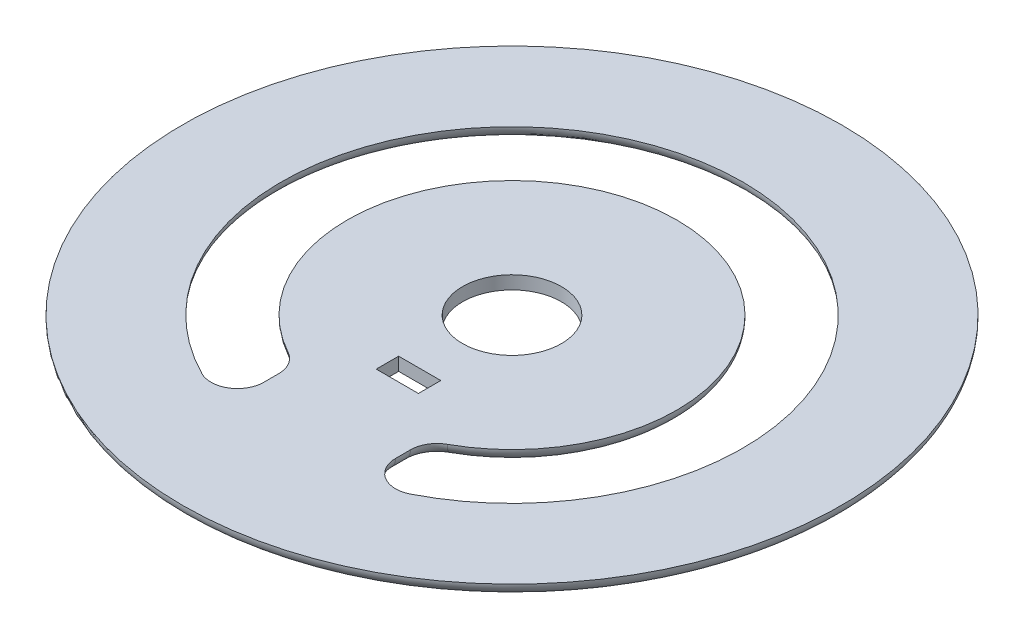
from build123d import *

# Parameters (mm, degrees)
SKETCH1_R           = 25
SKETCH1_R_2         = 3.75
SKETCH1_W           = 3.2
SKETCH1_H           = 1.7
BOSS_EXTRUDE1_DEPTH = 1
FILLET1_R           = 2
FILLET2_R           = 1


with BuildPart() as part:
    # Sketch1 → Boss-Extrude1 (new body)
    with BuildSketch(Plane(origin=(0, 0, 0), x_dir=(1, 0, 0), z_dir=(0, 1, 0))):
        with Locations(Location((0, 0, 0), (0, 0, 270))):
            Circle(SKETCH1_R)
        with Locations(Location((0, 0, 0), (0, 0, 270))):
            Circle(SKETCH1_R_2, mode=Mode.SUBTRACT)
        with BuildLine():
            Line((-5, -11.456439237), (-5, -16.770509831))
            ThreePointArc((-5, -16.770509831), (0, 17.5), (5, -16.770509831))
            Line((5, -16.770509831), (5, -11.456439237))
            ThreePointArc((5, -11.456439237), (0, 12.5), (-5, -11.456439237))
        make_face(mode=Mode.SUBTRACT)
        with Locations((0, -7.85)):
            Rectangle(SKETCH1_W, SKETCH1_H, mode=Mode.SUBTRACT)
    extrude(amount=BOSS_EXTRUDE1_DEPTH)

    # Fillet1
    fillet1_edges = [part.edges().sort_by_distance(p)[0] for p in [
        (-5, 0.5, 11.456439237),
        (5, 0.5, 11.456439237),
        (5, 0.5, 16.770509831),
        (-5, 0.5, 16.770509831),
    ]]
    fillet(fillet1_edges, radius=FILLET1_R)

    # Fillet2
    fillet2_edges = [part.edges().sort_by_distance(p)[0] for p in [
        (5.952730124, 0, 15.533202189),
        (5, 0, 13.263870893),
        (5.277932277, 0, 11.681329844),
        (0, 0, -12.5),
        (-5.277932277, 0, 11.681329844),
        (-5, 0, 13.263870893),
        (-5.952730124, 0, 15.533202189),
        (0, 0, -17.5),
        (0, 0, -25),
    ]]
    fillet(fillet2_edges, radius=FILLET2_R - 0.0001)  # a hair under: the kernel refuses the full size


solid = part.part
